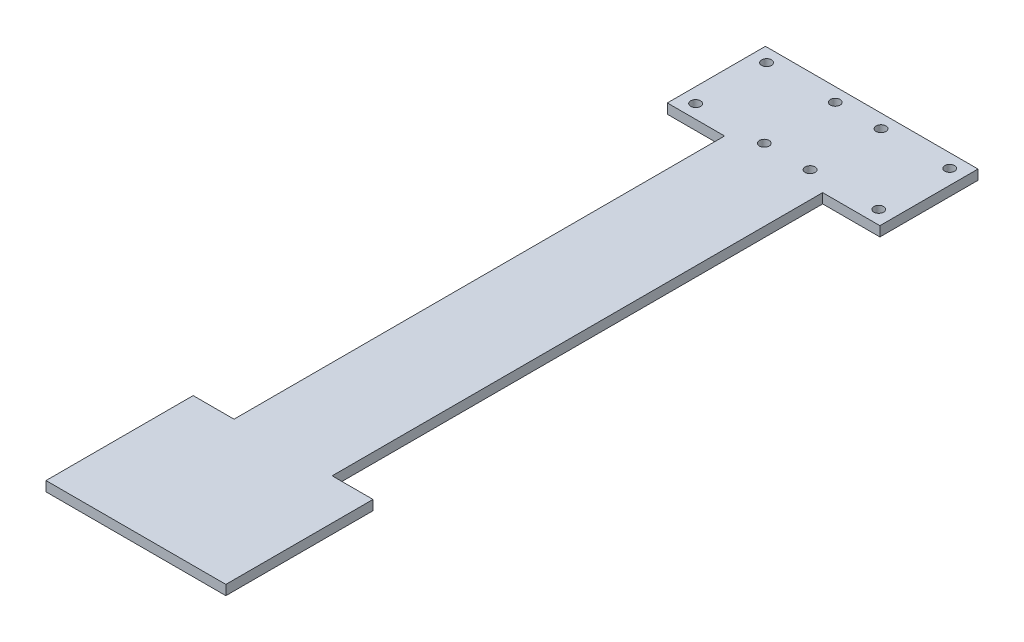
from build123d import *

# Parameters (mm, degrees)
BOSS_EXTRUDE1_DEPTH = 3
SKETCH2_R           = 1.5
CUT_EXTRUDE1_DEPTH  = 228.354898782


with BuildPart() as part:
    # Sketch1 → Boss-Extrude1 (new body)
    with BuildSketch(Plane(origin=(0, 0, 0), x_dir=(1, 0, 0), z_dir=(0, 1, 0))):
        Polygon((32.5, 225), (-32.5, 225), (-32.5, 195), (-15, 195), (-15, 45), (-27.5, 45), (-27.5, 0), (27.5, 0), (27.5, 45), (15, 45), (15, 195), (32.5, 195), align=None)
    extrude(amount=BOSS_EXTRUDE1_DEPTH)

    # Sketch2 → Cut-Extrude1 (cut, symmetric)
    with BuildSketch(Plane(origin=(0, 3, 0), x_dir=(1, 0, 0), z_dir=(0, 1, 0))):
        with Locations((-28, 220.85)):
            Circle(SKETCH2_R)
        with Locations((-7, 220.85)):
            Circle(SKETCH2_R)
        with Locations((-28, 199.15)):
            Circle(SKETCH2_R)
        with Locations((-7, 199.15)):
            Circle(SKETCH2_R)
    cut_extrude1 = extrude(amount=CUT_EXTRUDE1_DEPTH, both=True, mode=Mode.SUBTRACT)

    # Mirror1: Cut-Extrude1 across plane
    add(cut_extrude1.mirror(Plane(origin=(0, 0, 0), x_dir=(0, 0, 1), z_dir=(1, 0, 0))), mode=Mode.SUBTRACT)


solid = part.part
